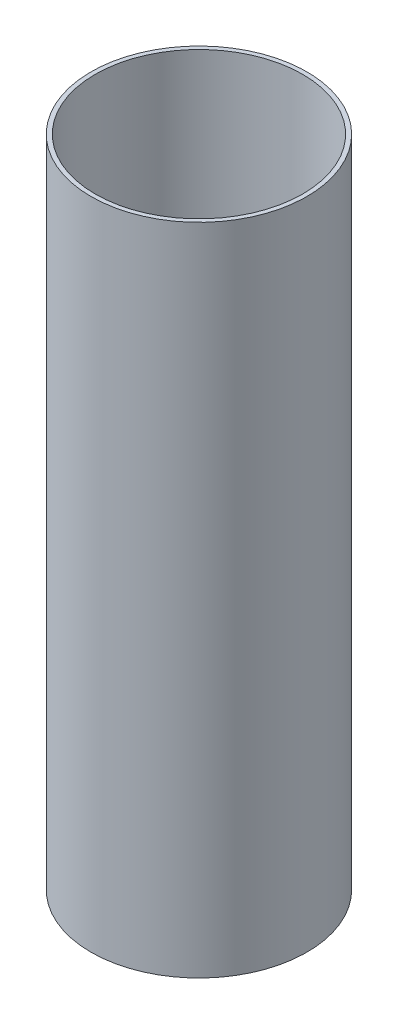
from build123d import *

# Parameters (mm, degrees)
SKETCH1_R           = 37.95
SKETCH1_R_2         = 36.45
BOSS_EXTRUDE1_DEPTH = 230


with BuildPart() as part:
    # Sketch1 → Boss-Extrude1 (new body)
    with BuildSketch(Plane(origin=(0, 0, 0), x_dir=(1, 0, 0), z_dir=(0, 1, 0))):
        Circle(SKETCH1_R)
        Circle(SKETCH1_R_2, mode=Mode.SUBTRACT)
    extrude(amount=BOSS_EXTRUDE1_DEPTH)


solid = part.part
